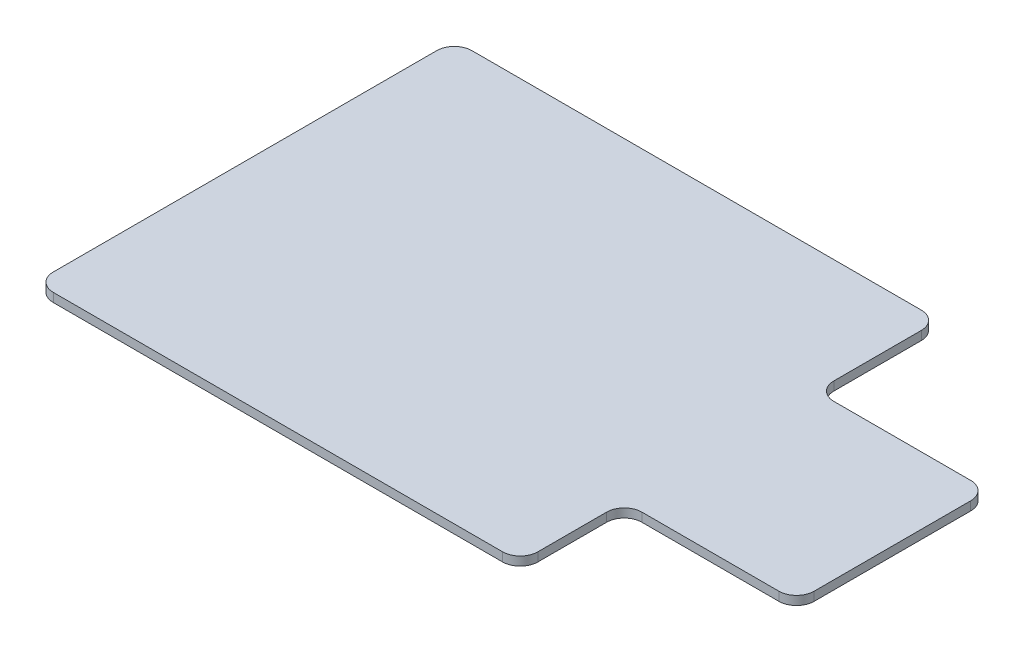
from build123d import *

# Parameters (mm, degrees)
BOSS_EXTRUDE1_DEPTH = 2.54


with BuildPart() as part:
    # Sketch1 → Boss-Extrude1 (new body)
    with BuildSketch(Plane(origin=(0, 0, 0), x_dir=(1, 0, 0), z_dir=(0, 1, 0))):
        with BuildLine():
            ThreePointArc((74.872929465, 24.930432309), (71.280827017, 26.418329861), (69.792929465, 30.010432309))
            Line((69.792929465, 30.010432309), (69.792929465, 55.219715586))
            ThreePointArc((69.792929465, 55.219715586), (68.305031914, 58.811818034), (64.712929465, 60.299715586))
            Line((64.712929465, 60.299715586), (-64.712929465, 60.299715586))
            ThreePointArc((-64.712929465, 60.299715586), (-68.305031914, 58.811818034), (-69.792929465, 55.219715586))
            Line((-69.792929465, 55.219715586), (-69.792929465, -55.219715586))
            ThreePointArc((-69.792929465, -55.219715586), (-68.305031914, -58.811818034), (-64.712929465, -60.299715586))
            Line((-64.712929465, -60.299715586), (64.712929465, -60.299715586))
            ThreePointArc((64.712929465, -60.299715586), (68.305031914, -58.811818034), (69.792929465, -55.219715586))
            Line((69.792929465, -55.219715586), (69.792929465, -35.41407281))
            ThreePointArc((69.792929465, -35.41407281), (71.280827017, -31.821970362), (74.872929465, -30.33407281))
            Line((74.872929465, -30.33407281), (114.328174061, -30.33407281))
            ThreePointArc((114.328174061, -30.33407281), (117.92027651, -28.846175258), (119.408174061, -25.25407281))
            Line((119.408174061, -25.25407281), (119.408174061, 19.850432309))
            ThreePointArc((119.408174061, 19.850432309), (117.92027651, 23.442534758), (114.328174061, 24.930432309))
            Line((114.328174061, 24.930432309), (74.872929465, 24.930432309))
        make_face()
    extrude(amount=BOSS_EXTRUDE1_DEPTH)


solid = part.part
